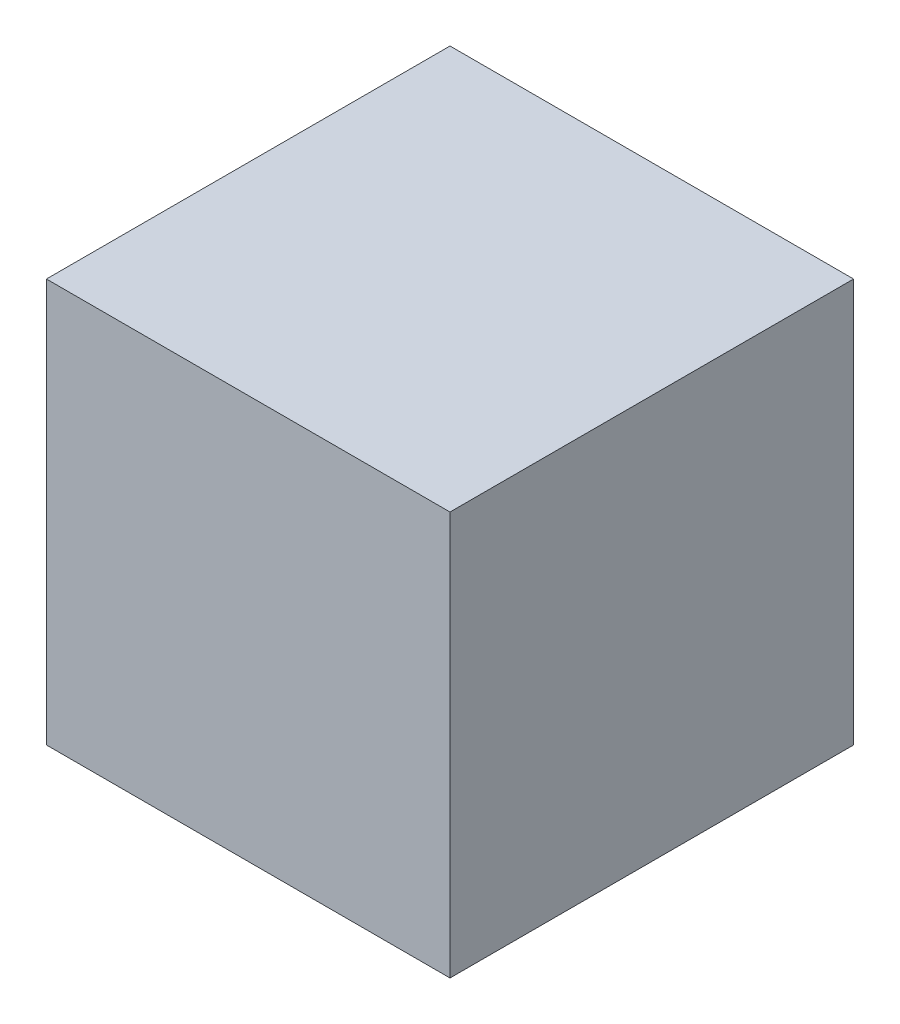
from build123d import *

# Parameters (mm, degrees)
SKETCH1_W           = 203.2
SKETCH1_H           = 203.2
BOSS_EXTRUDE1_DEPTH = 203.2
SKETCH2_W           = 92.964
SKETCH2_H           = 77.8002
BOSS_EXTRUDE2_DEPTH = 20.32


with BuildPart() as part:
    # Sketch1 → Boss-Extrude1 (new body)
    with BuildSketch(Plane(origin=(0, 0, 0), x_dir=(1, 0, 0), z_dir=(0, 1, 0))):
        with Locations((-12.7, 0)):
            Rectangle(SKETCH1_W, SKETCH1_H)
    extrude(amount=BOSS_EXTRUDE1_DEPTH)


with BuildPart() as body_2:
    # Sketch2 → Boss-Extrude2 (new body)
    with BuildSketch(Plane(origin=(0, 0, 0), x_dir=(1, 0, 0), z_dir=(0, 1, 0))):
        Rectangle(SKETCH2_W, SKETCH2_H)
    extrude(amount=BOSS_EXTRUDE2_DEPTH)


solid = Compound([part.part, body_2.part])
